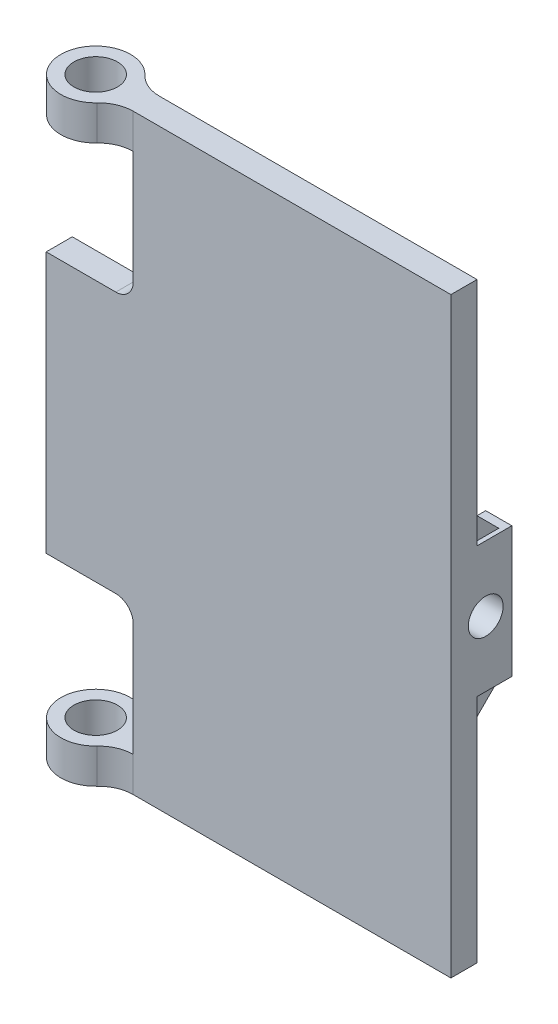
from build123d import *

# Parameters (mm, degrees)
SKETCH_1_W          = 36.5
SKETCH_1_H          = 68
EXTRUDE_1_DEPTH     = 3
SKETCH_2_R          = 2.5
EXTRUDE_2_DEPTH     = 4
EXTRUDE_START       = -4
EXTRUDE_3_DEPTH     = 4
CUT_EXTRUDE_START   = -4
SKETCH_4_R          = 2.5
CUT_EXTRUDE_1_DEPTH = 4
SKETCH_5_W          = 3
SKETCH_5_H          = 15
EXTRUDE_4_DEPTH     = 4
CUT_EXTRUDE_2_DEPTH = 2
SKETCH_7_R          = 2
CUT_EXTRUDE_3_DEPTH = 5
EXTRUDE_5_DEPTH     = 1
SKETCH_9_W          = 10
SKETCH_9_H          = 30
EXTRUDE_6_DEPTH     = 3
FILLET_1_R          = 2
FILLET_2_R          = 1


with BuildPart() as part:
    # 草图1 → 凸台-拉伸1 (new body)
    with BuildSketch(Plane.XY):
        Rectangle(SKETCH_1_W, SKETCH_1_H)
    extrude(amount=EXTRUDE_1_DEPTH)

    # 草图2 → 凸台-拉伸2 (add)
    with BuildSketch(Plane.XZ.offset(34)):
        with BuildLine():
            Line((-18.25, 3), (-18.25, 0))
            ThreePointArc((-18.25, 0), (-19.83113883, -0.325765386), (-21.15473751, -1.25))
            ThreePointArc((-21.15473751, -1.25), (-28.059475019, 1.5), (-21.15473751, 4.25))
            ThreePointArc((-21.15473751, 4.25), (-19.83113883, 3.325765386), (-18.25, 3))
        make_face()
        with Locations(Location((-24.059475019, 1.5, 0), (0, 0, 270))):
            Circle(SKETCH_2_R, mode=Mode.SUBTRACT)
    extrude(amount=-EXTRUDE_2_DEPTH)

    # 草图3 → 凸台-拉伸3 (add)
    with BuildSketch(Plane(origin=(0, 34, 0), x_dir=(1, 0, 0), z_dir=(0, 1, 0)).offset(EXTRUDE_START)):
        with BuildLine():
            Line((-18.25, -3), (-18.25, 0))
            ThreePointArc((-18.25, 0), (-19.83113883, 0.325765386), (-21.15473751, 1.25))
            ThreePointArc((-21.15473751, 1.25), (-28.059475019, -1.5), (-21.15473751, -4.25))
            ThreePointArc((-21.15473751, -4.25), (-19.83113883, -3.325765386), (-18.25, -3))
        make_face()
    extrude(amount=EXTRUDE_3_DEPTH)

    # 草图4 → 切除-拉伸1 (cut)
    with BuildSketch(Plane(origin=(0, 34, 0), x_dir=(1, 0, 0), z_dir=(0, 1, 0)).offset(CUT_EXTRUDE_START)):
        with Locations(Location((-24.059475019, -1.5, 0), (0, 0, 90))):
            Circle(SKETCH_4_R)
    extrude(amount=CUT_EXTRUDE_1_DEPTH, mode=Mode.SUBTRACT)

    # 草图5 → 凸台-拉伸4 (add)
    with BuildSketch(Plane(origin=(0, 0, 0), x_dir=(-1, 0, 0), z_dir=(0, 0, -1))):
        with Locations((-16.75, 0)):
            Rectangle(SKETCH_5_W, SKETCH_5_H)
    extrude(amount=EXTRUDE_4_DEPTH)

    # 草图6 → 切除-拉伸2 (cut)
    with BuildSketch(Plane(origin=(0, 0, 0), x_dir=(-1, 0, 0), z_dir=(0, 0, -1))):
        Polygon((-15.25, 7.5), (-15.25, 15), (-3.25, 15), (-3.25, -15), (-15.25, -15), (-15.25, -7.5), align=None)
    extrude(amount=-CUT_EXTRUDE_2_DEPTH, mode=Mode.SUBTRACT)

    # 草图7 → 切除-拉伸3 (cut)
    with BuildSketch(Plane(origin=(18.25, 0, 0), x_dir=(0, 0, -1), z_dir=(1, 0, 0))):
        with Locations((1, 0)):
            Circle(SKETCH_7_R)
    extrude(amount=-CUT_EXTRUDE_3_DEPTH, mode=Mode.SUBTRACT)

    # 草图8 → 凸台-拉伸5 (add, symmetric)
    with BuildSketch(Plane.ZY.offset(-16.75)):
        Polygon((-3, 7.5), (0, 10.5), (0, 7.5), align=None)
    extrude_5 = extrude(amount=EXTRUDE_5_DEPTH, both=True)

    # 镜向1: 凸台-拉伸5 across plane
    add(extrude_5.mirror(Plane.ZX))

    # 草图9 → 凸台-拉伸6 (add)
    with BuildSketch(Plane.XY.offset(3)):
        with Locations((-23.25, 0)):
            Rectangle(SKETCH_9_W, SKETCH_9_H)
    extrude(amount=-EXTRUDE_6_DEPTH)

    # 圆角1
    fillet_1_edges = [part.edges().sort_by_distance(p)[0] for p in [
        (-18.25, 15, 1.5),
        (-18.25, -15, 1.5),
    ]]
    fillet(fillet_1_edges, radius=FILLET_1_R)

    # 圆角2
    fillet_2_edges = [part.edges().sort_by_distance(p)[0] for p in [
        (15.25, 0, 2),
    ]]
    fillet(fillet_2_edges, radius=FILLET_2_R - 0.0001)  # a hair under: the kernel refuses the full size


solid = part.part
